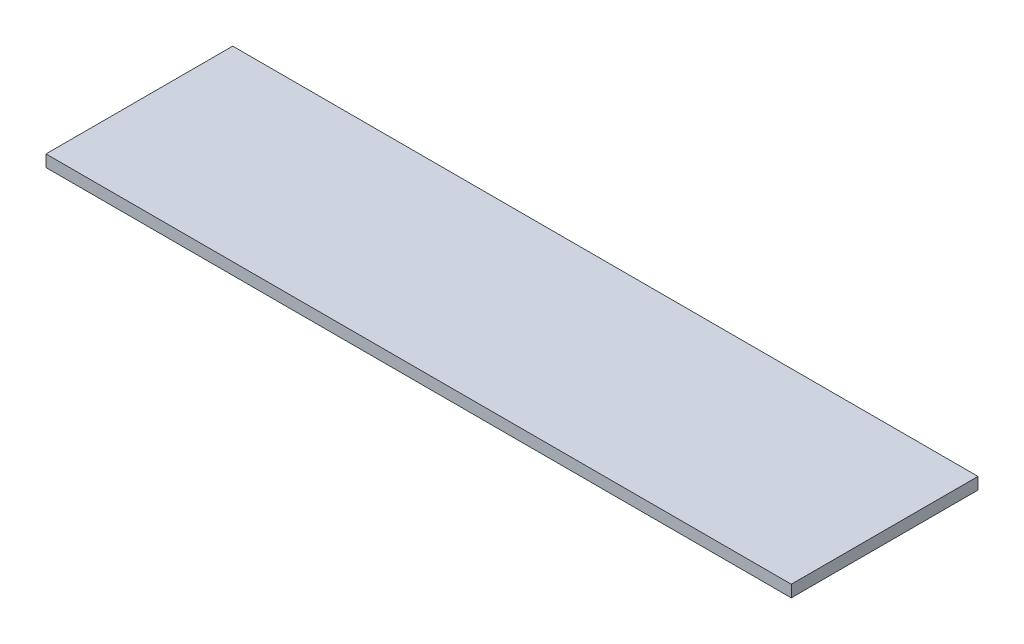
from build123d import *

# Parameters (mm, degrees)
SKETCH1_W           = 199.58
SKETCH1_H           = 30
BOSS_EXTRUDE1_DEPTH = 3.175
SKETCH2_W           = 199.58
SKETCH2_H           = 3.175
BOSS_EXTRUDE2_DEPTH = 20


with BuildPart() as part:
    # Sketch1 → Boss-Extrude1 (new body)
    with BuildSketch(Plane(origin=(0, 0, 0), x_dir=(1, 0, 0), z_dir=(0, 1, 0))):
        with Locations((99.79, 15)):
            Rectangle(SKETCH1_W, SKETCH1_H)
    extrude(amount=BOSS_EXTRUDE1_DEPTH)

    # Sketch2 → Boss-Extrude2 (add)
    with BuildSketch(Plane(origin=(0, 0, -30), x_dir=(-1, 0, 0), z_dir=(0, 0, -1))):
        with Locations((-99.79, 1.5875)):
            Rectangle(SKETCH2_W, SKETCH2_H)
    extrude(amount=BOSS_EXTRUDE2_DEPTH)


solid = part.part
